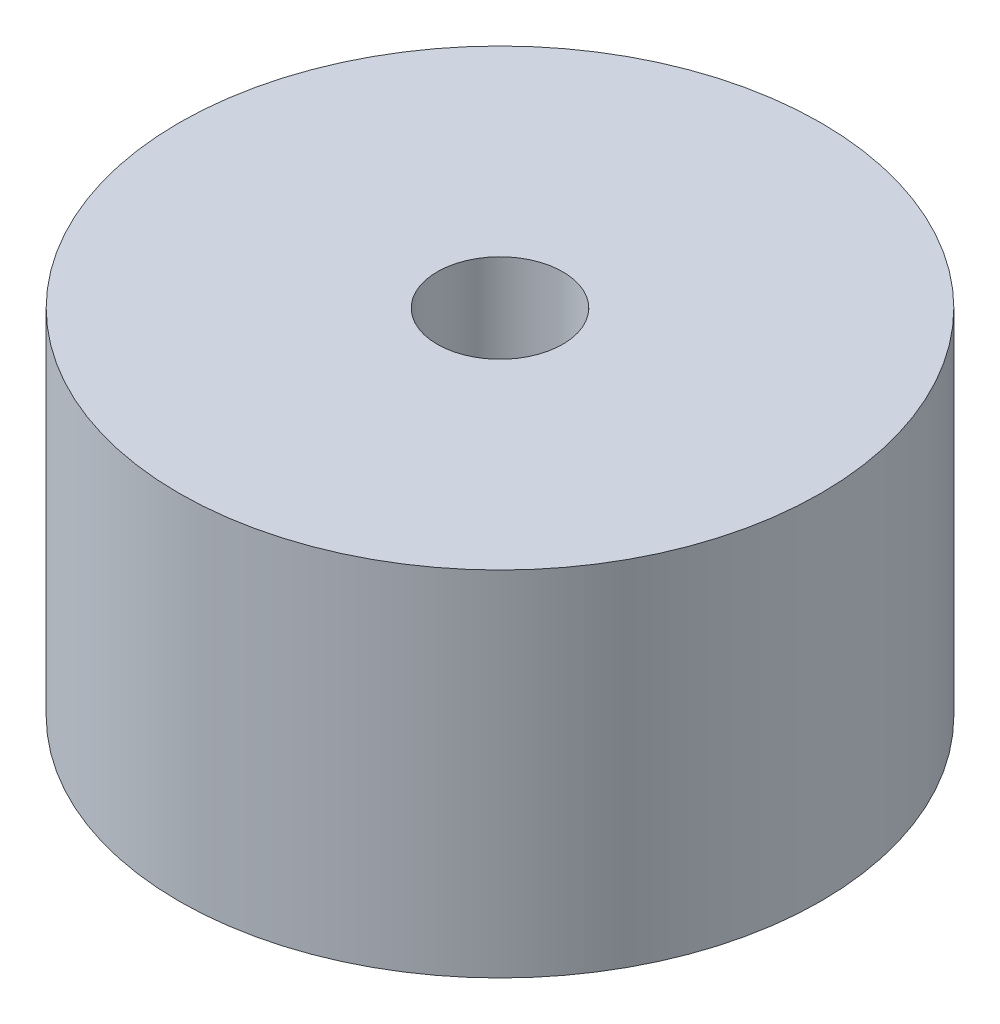
from build123d import *

# Parameters (mm, degrees)
BOSS_EXTRUDE1_DEPTH      = 6
BOSS_EXTRUDE1_DEPTH_BACK = 3
SKETCH1_R                = 8.175
SKETCH1_R_2              = 1.6
SKETCH1_3_R              = 8.175
SKETCH1_3_R_2            = 1.6
BOSS_EXTRUDE2_DEPTH      = 3
SKETCH2_R                = 1
CUT_EXTRUDE1_DEPTH       = 15
SKETCH4_R                = 3.5
BOSS_EXTRUDE3_DEPTH      = 3
SKETCH1_7_R              = 1.6
CUT_EXTRUDE2_DEPTH       = 13


with BuildPart() as part:
    # Sketch1 → Boss-Extrude1 (new, two sides: drawn at the far end of the back side and taken through both)
    with BuildSketch(Plane(origin=(0, 0, 0), x_dir=(1, 0, 0), z_dir=(0, 1, 0)).offset(-BOSS_EXTRUDE1_DEPTH_BACK)):
        Circle(SKETCH1_R)
        Circle(SKETCH1_R_2, mode=Mode.SUBTRACT)
    extrude(amount=BOSS_EXTRUDE1_DEPTH + BOSS_EXTRUDE1_DEPTH_BACK)

    # Sketch2 → Cut-Extrude1 (cut)
    with BuildSketch(Plane(origin=(0, 0, 0), x_dir=(0, 0, -1), z_dir=(1, 0, 0))):
        with Locations((0, 3)):
            Circle(SKETCH2_R)
    extrude(amount=-CUT_EXTRUDE1_DEPTH, mode=Mode.SUBTRACT)



with BuildPart() as body_2:
    # Sketch1<3> → Boss-Extrude2 (new body)
    with BuildSketch(Plane(origin=(0, 0, 0), x_dir=(1, 0, 0), z_dir=(0, 1, 0))):
        Circle(SKETCH1_3_R)
        Circle(SKETCH1_3_R_2, mode=Mode.SUBTRACT)
    extrude(amount=-BOSS_EXTRUDE2_DEPTH)


with BuildPart() as part_1:
    add(part.part)

    add(body_2.part)  # Boss-Extrude3 merges body 2
    # Sketch4 → Boss-Extrude3 (add)
    with BuildSketch(Plane.XZ.offset(3)):
        Circle(SKETCH4_R)
    extrude(amount=BOSS_EXTRUDE3_DEPTH)

    # Sketch1<7> → Cut-Extrude2 (cut)
    with BuildSketch(Plane(origin=(0, 0, 0), x_dir=(1, 0, 0), z_dir=(0, 1, 0))):
        Circle(SKETCH1_7_R)
    extrude(amount=-CUT_EXTRUDE2_DEPTH, mode=Mode.SUBTRACT)


solid = part_1.part
